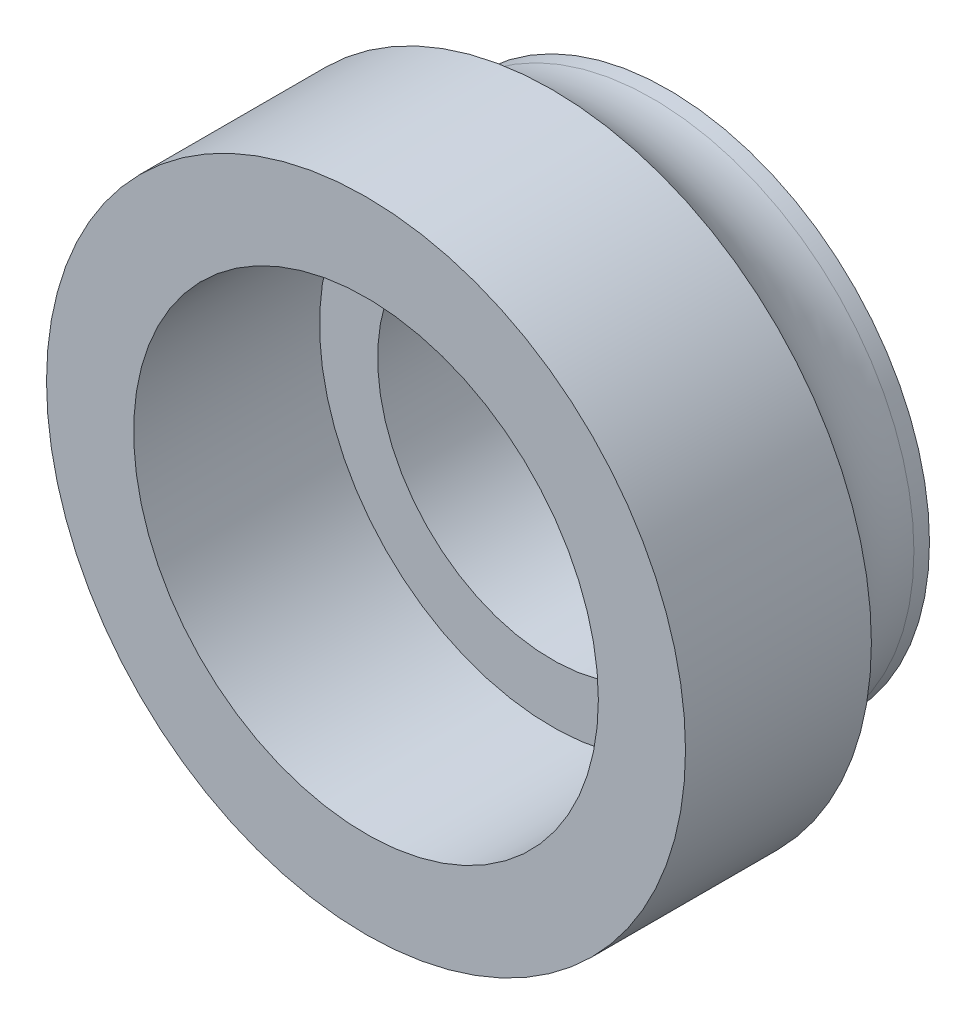
from build123d import *

# Parameters (mm, degrees)
CROQUIS1_R              = 4.5
CROQUIS1_R_2            = 3
SALIENTE_EXTRUIR1_DEPTH = 2
CROQUIS2_R              = 5.5
CROQUIS2_R_2            = 4
SALIENTE_EXTRUIR2_DEPTH = 3.2
REDONDEO1_R             = 2


with BuildPart() as part:
    # Croquis1 → Saliente-Extruir1 (new body)
    with BuildSketch(Plane.XY):
        Circle(CROQUIS1_R)
        Circle(CROQUIS1_R_2, mode=Mode.SUBTRACT)
    extrude(amount=SALIENTE_EXTRUIR1_DEPTH)

    # Croquis2 → Saliente-Extruir2 (add)
    with BuildSketch(Plane.XY.offset(2)):
        Circle(CROQUIS2_R)
        Circle(CROQUIS2_R_2, mode=Mode.SUBTRACT)
    extrude(amount=SALIENTE_EXTRUIR2_DEPTH)

    # Redondeo1
    # the kernel refuses this fillet: 2 mm, written as the material it adds along each edge
    with BuildSketch(Plane(origin=(0, 0, 2), x_dir=(1, 0, 0), z_dir=(0, -1, 0))) as redondeo1_piece_1:
        with BuildLine():
            CenterArc((6.5, -1.732050808), REDONDEO1_R, 120, 60)
            Line((5.5, 0), (5.48, 0.034641016))
            ThreePointArc((5.48, 0.034641016), (5, 0.04), (4.5, 0.04))
            Line((4.5, 0.04), (4.46, 0))
            Line((4.46, 0), (4.46, -1.732050808))
            Line((4.46, -1.732050808), (4.5, -1.732050808))
        make_face()
    revolve(axis=Axis((0, 0, 2), (0, 0, 1)))


solid = part.part
